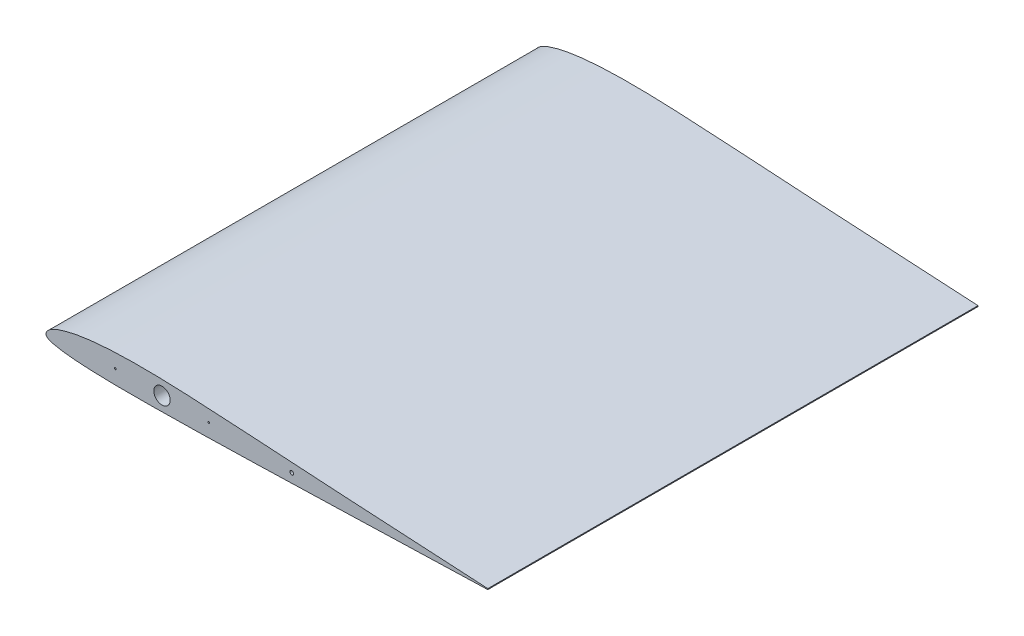
from build123d import *

# Parameters (mm, degrees)
AIRFOIL_DEPTH        = 225.425
CAMERA_CHANNEL_REACH = 305.62
SKETCH8_R            = 3.7592
SKETCH9_R            = 0.8636
CUT_EXTRUDE1_DEPTH   = 304.620080002
SKETCH10_R           = 0.4064
CUT_EXTRUDE2_DEPTH   = 304.620080002


with BuildPart() as part:
    # Sketch3 → Airfoil (new body)
    with BuildSketch(Plane.XY):
        with BuildLine():
            Line((203.2026416, 0.2115312), (203.1973584, -0.2115312))
            add(Edge.make_bspline(
                [(203.2026416, 0.2115312), (202.749975414, 0.235767735), (201.482227455, 0.303645165), (199.229899451, 0.427581862), (196.304631843, 0.58645357), (192.978703522, 0.769351745), (189.375038631, 0.970599063), (185.612938037, 1.178498421), (181.773697727, 1.395742795), (177.899622281, 1.614727685), (174.009999544, 1.835420869), (170.113241345, 2.055248875), (166.213278896, 2.277505712), (162.311711246, 2.498550948), (158.410741475, 2.722039599), (154.51059314, 2.944050358), (150.614228349, 3.167765812), (146.720449867, 3.393606246), (142.830938385, 3.617021658), (138.944036437, 3.845362214), (135.059465523, 4.072120956), (131.177542014, 4.301224247), (127.296716125, 4.531457234), (123.418858544, 4.764935655), (119.542057199, 5.000803845), (115.667451592, 5.239845443), (111.794903734, 5.481590715), (107.92356364, 5.724700666), (104.057153857, 5.968055719), (100.189436188, 6.212019472), (96.318759225, 6.454299415), (92.447746967, 6.694605077), (88.584023823, 6.932155402), (84.741460885, 7.163725688), (80.922901098, 7.388921542), (77.397782248, 7.59058238), (74.522903974, 7.749287039), (71.994617804, 7.884276403), (69.124106699, 8.032386004), (65.508268577, 8.20759336), (61.485211762, 8.383132514), (57.521769068, 8.532806767), (53.67337931, 8.65196061), (49.905829014, 8.739019457), (46.180960609, 8.791245505), (42.490964532, 8.80473096), (38.846800487, 8.774220372), (35.259629974, 8.696203332), (31.756076473, 8.567101257), (28.366063073, 8.385637047), (25.12916512, 8.151985933), (22.079780002, 7.868751339), (19.258728777, 7.54280933), (16.701884478, 7.183689544), (14.433629815, 6.805801873), (12.454092042, 6.421559693), (10.747122797, 6.041820295), (9.282979556, 5.674052725), (8.026380981, 5.32164067), (6.939364861, 4.984377042), (5.987597489, 4.659887308), (5.142872565, 4.34265889), (4.375389754, 4.030109088), (3.657744375, 3.708063164), (2.964607554, 3.360683786), (2.286752141, 2.970800639), (1.638361257, 2.53049627), (1.049962466, 2.035518438), (0.55105342, 1.482304271), (0.182124171, 0.879494893), (0.020226764, 0.365089231), (-0.006478658, -0.019297801), (0.019393578, -0.313623078), (0.126773921, -0.614429835), (0.296985654, -0.854594391), (0.474203046, -1.0360418), (0.692231827, -1.205448428), (0.984641636, -1.3848123), (1.352473451, -1.566840486), (1.779379473, -1.744801104), (2.260500407, -1.917169047), (2.806664849, -2.087583046), (3.441332814, -2.260164552), (4.188115361, -2.438004982), (5.06690206, -2.621532136), (6.092157789, -2.806861911), (7.276571085, -2.993059902), (8.634334508, -3.178000051), (10.186878433, -3.35940408), (11.960820402, -3.536894099), (13.988248891, -3.707664418), (16.294928682, -3.868904436), (18.89372996, -4.015528606), (21.766154486, -4.143679461), (24.87293007, -4.249244795), (28.158435839, -4.329742718), (31.577459925, -4.386681674), (35.091351007, -4.420650673), (38.679106505, -4.435118029), (42.321638443, -4.431127332), (46.012586406, -4.412453932), (49.757901166, -4.379533307), (53.580508995, -4.337179517), (57.514943683, -4.284200631), (61.595949927, -4.220224301), (65.884086903, -4.144461591), (69.583989281, -4.072095586), (72.808820505, -4.005043155), (75.579862857, -3.944754288), (78.770794894, -3.87272284), (82.213745044, -3.790898591), (85.812278509, -3.702057045), (89.454775682, -3.609141494), (93.150227317, -3.511616573), (96.888909494, -3.411069637), (100.657029944, -3.306886052), (104.439744756, -3.201756582), (108.224810971, -3.094514402), (112.008194618, -2.986301144), (115.791031649, -2.876635979), (119.578217649, -2.765818396), (123.376483987, -2.65229883), (127.194486092, -2.537598816), (131.04164704, -2.420012089), (134.919802339, -2.301989441), (138.81936176, -2.182338271), (142.726333168, -2.060156236), (146.633431624, -1.937306429), (150.540542811, -1.8169006), (154.447614149, -1.693516374), (158.354722861, -1.573509134), (162.26148206, -1.451514239), (166.167503923, -1.331681527), (170.071797885, -1.208888837), (173.972889131, -1.08970993), (177.866894682, -0.967751167), (181.74532249, -0.848820183), (185.588910116, -0.731171396), (189.354936457, -0.616949477), (192.962622684, -0.509627047), (196.29203641, -0.412964276), (199.220341745, -0.324818889), (201.475188064, -0.261715668), (202.74429193, -0.224733669), (203.1973584, -0.2115312)],
                knots=[0, 0, 0, 0, 0.003315783, 0.009286262, 0.01649964, 0.024744274, 0.033650618, 0.042899826, 0.052304254, 0.061777775, 0.071282103, 0.080800776, 0.090326048, 0.099854782, 0.109384674, 0.118906596, 0.128428716, 0.137931689, 0.147435622, 0.156925556, 0.166411563, 0.175897802, 0.185369409, 0.194847889, 0.20431387, 0.213778822, 0.22324269, 0.232694875, 0.242151635, 0.251579623, 0.261041636, 0.270519226, 0.279948764, 0.289356316, 0.298676754, 0.307928254, 0.315183044, 0.31973714, 0.326447814, 0.336207398, 0.346216249, 0.35590244, 0.365218591, 0.374378655, 0.38346733, 0.392466507, 0.40136886, 0.410122896, 0.418710299, 0.427012022, 0.434953476, 0.442446764, 0.449411134, 0.455723479, 0.461330459, 0.466229103, 0.470471324, 0.474119786, 0.477269946, 0.48001617, 0.482443707, 0.48462406, 0.486615379, 0.48850422, 0.490376245, 0.492284157, 0.494220159, 0.496101738, 0.49789553, 0.499645689, 0.501236957, 0.501776184, 0.502456996, 0.50338555, 0.504071488, 0.504595279, 0.505236101, 0.506085552, 0.507100329, 0.508234964, 0.509466926, 0.51083723, 0.512418824, 0.514276846, 0.516451552, 0.518984588, 0.521896832, 0.525220723, 0.529007031, 0.533329617, 0.538260507, 0.543888673, 0.550242528, 0.557299236, 0.564919576, 0.572979857, 0.581338081, 0.589931372, 0.59868335, 0.607580916, 0.616574706, 0.62568118, 0.63497715, 0.644536982, 0.654462302, 0.664831439, 0.675907565, 0.68153051, 0.688424661, 0.696181232, 0.704876621, 0.713615329, 0.722510831, 0.73152844, 0.74065523, 0.749867421, 0.759101002, 0.768334695, 0.777564511, 0.786785993, 0.796015995, 0.805277853, 0.814580932, 0.823955486, 0.833431168, 0.842960949, 0.852492353, 0.862022798, 0.871553661, 0.881084601, 0.890615434, 0.900145802, 0.909674638, 0.919199589, 0.928717996, 0.938222598, 0.947696375, 0.957100207, 0.966349803, 0.975255754, 0.983500408, 0.990713161, 0.996684625, 1, 1, 1, 1], degree=3))
        make_face()
    extrude(amount=AIRFOIL_DEPTH)

    # Sketch8 → Camera Channel (cut, up to next)
    with BuildSketch(Plane(origin=(0, 0, 0), x_dir=(-1, 0, 0), z_dir=(0, 0, -1)), mode=Mode.PRIVATE) as camera_channel_sk1:
        with Locations((-53.339999981, 2.15866289)):
            Circle(SKETCH8_R)
    camera_channel_tool1 = extrude(camera_channel_sk1.sketch, amount=-CAMERA_CHANNEL_REACH, mode=Mode.PRIVATE) & part.part
    add(camera_channel_tool1.solids().sort_by_distance((53.34, 2.158663, 0))[0], mode=Mode.SUBTRACT)

    # Sketch9 → Cut-Extrude1 (cut, through all)
    with BuildSketch(Plane(origin=(0, 0, 0), x_dir=(-1, 0, 0), z_dir=(0, 0, -1))):
        with Locations((-113.029999981, 1.22400007)):
            Circle(SKETCH9_R)
    extrude(amount=-CUT_EXTRUDE1_DEPTH, mode=Mode.SUBTRACT)

    # Sketch10 → Cut-Extrude2 (cut, through all)
    with BuildSketch(Plane(origin=(0, 0, 0), x_dir=(-1, 0, 0), z_dir=(0, 0, -1))):
        with Locations((-74.802999981, 2.15866289)):
            Circle(SKETCH10_R)
        with Locations((-31.876999981, 2.15866289)):
            Circle(SKETCH10_R)
    extrude(amount=-CUT_EXTRUDE2_DEPTH, mode=Mode.SUBTRACT)


solid = part.part
